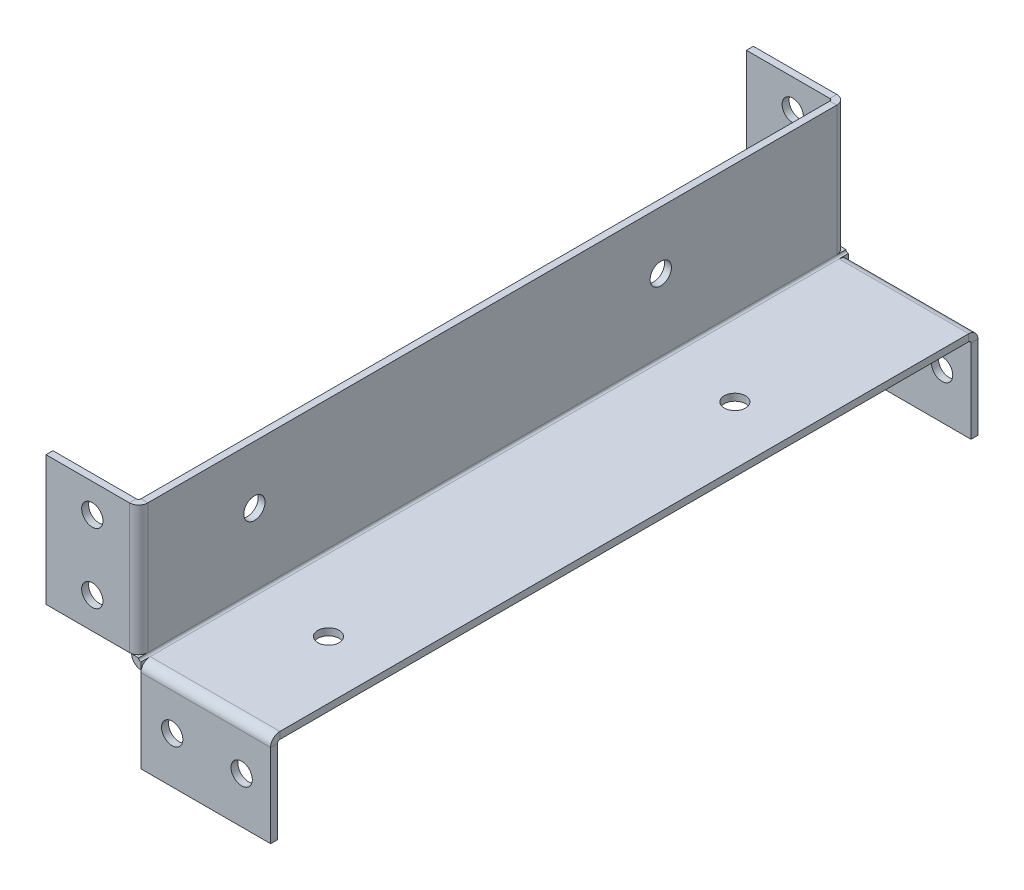
from build123d import *

# Parameters (mm, degrees)
SKETCH1_W                      = 60
SKETCH1_H                      = 305.5
BASE_FLANGE1_DEPTH             = 3
EDGE_FLANGE1_STRIP_W           = 14
EDGE_FLANGE1_STRIP_H           = 3
EDGE_FLANGE1_STRIP_CUT_DEPTH   = 305.5
EDGE_FLANGE1_DEPTH             = 305.5
EDGE_FLANGE2_STRIP_W           = 14
EDGE_FLANGE2_STRIP_H           = 3
EDGE_FLANGE2_STRIP_CUT_DEPTH   = 56
EDGE_FLANGE2_STRIP_2_W         = 14
EDGE_FLANGE2_STRIP_2_H         = 3
EDGE_FLANGE2_STRIP_CUT_2_DEPTH = 56
EDGE_FLANGE2_STRIP_3_W         = 14
EDGE_FLANGE2_STRIP_3_H         = 3
EDGE_FLANGE2_STRIP_CUT_3_DEPTH = 56
EDGE_FLANGE2_STRIP_4_W         = 14
EDGE_FLANGE2_STRIP_4_H         = 3
EDGE_FLANGE2_STRIP_CUT_4_DEPTH = 56
EDGE_FLANGE2_DEPTH             = 56
EDGE_FLANGE2_BEND_DEPTH        = 56
EDGE_FLANGE2_BEND_2_DEPTH      = 56
EDGE_FLANGE2_BEND_3_DEPTH      = 56
SKETCH18_R                     = 4.6
EXTRUDE1_DEPTH                 = 319.463891203
SKETCH19_R                     = 4.6
EXTRUDE2_DEPTH                 = 3
SKETCH20_R                     = 4.6
EXTRUDE3_DEPTH                 = 3


# Sheet-metal steps are written as plain solids
with BuildPart() as part:
    # Sketch1 → Base-Flange1 (new body)
    with BuildSketch(Plane(origin=(0, 0, 0), x_dir=(1, 0, 0), z_dir=(0, 1, 0))):
        Rectangle(SKETCH1_W, SKETCH1_H)
    extrude(amount=BASE_FLANGE1_DEPTH)

    # Edge-Flange1 strip (across the edge) → Edge-Flange1 strip cut (cut)
    with BuildSketch(Plane(origin=(-30, 3, -152.75), x_dir=(1, 0, 0), z_dir=(0, 0, 1))):
        with Locations((-3, -1.5)):
            Rectangle(EDGE_FLANGE1_STRIP_W, EDGE_FLANGE1_STRIP_H)
    extrude(amount=EDGE_FLANGE1_STRIP_CUT_DEPTH, mode=Mode.SUBTRACT)

    # Edge-Flange1 section (across the edge) → Edge-Flange1 (add)
    with BuildSketch(Plane(origin=(-30, 3, -152.75), x_dir=(1, 0, 0), z_dir=(0, 0, 1))):
        with BuildLine():
            Line((0, 1), (0, 57))
            Line((0, 57), (3, 57))
            Line((3, 57), (3, 1))
            ThreePointArc((3, 1), (3.292893219, 0.292893219), (4, 0))
            Line((4, 0), (4, -3))
            ThreePointArc((4, -3), (1.171572875, -1.828427125), (0, 1))
        make_face()
    extrude(amount=EDGE_FLANGE1_DEPTH)

    # Edge-Flange2 strip (across the edge) → Edge-Flange2 strip cut (cut)
    with BuildSketch(Plane(origin=(-30, 4, 152.75), x_dir=(0, 0, -1), z_dir=(0, 1, 0))):
        with Locations((-3, -1.5)):
            Rectangle(EDGE_FLANGE2_STRIP_W, EDGE_FLANGE2_STRIP_H)
    extrude(amount=EDGE_FLANGE2_STRIP_CUT_DEPTH, mode=Mode.SUBTRACT)

    # Edge-Flange2 strip 2 (across the edge) → Edge-Flange2 strip cut 2 (cut)
    with BuildSketch(Plane(origin=(30, 0, 152.75), x_dir=(0, 0, -1), z_dir=(-1, 0, 0))):
        with Locations((-3, -1.5)):
            Rectangle(EDGE_FLANGE2_STRIP_2_W, EDGE_FLANGE2_STRIP_2_H)
    extrude(amount=EDGE_FLANGE2_STRIP_CUT_2_DEPTH, mode=Mode.SUBTRACT)

    # Edge-Flange2 strip 3 (across the edge) → Edge-Flange2 strip cut 3 (cut)
    with BuildSketch(Plane(origin=(-30, 60, -152.75), x_dir=(0, 0, 1), z_dir=(0, -1, 0))):
        with Locations((-3, -1.5)):
            Rectangle(EDGE_FLANGE2_STRIP_3_W, EDGE_FLANGE2_STRIP_3_H)
    extrude(amount=EDGE_FLANGE2_STRIP_CUT_3_DEPTH, mode=Mode.SUBTRACT)

    # Edge-Flange2 strip 4 (across the edge) → Edge-Flange2 strip cut 4 (cut)
    with BuildSketch(Plane(origin=(-26, 0, -152.75), x_dir=(0, 0, 1), z_dir=(1, 0, 0))):
        with Locations((-3, -1.5)):
            Rectangle(EDGE_FLANGE2_STRIP_4_W, EDGE_FLANGE2_STRIP_4_H)
    extrude(amount=EDGE_FLANGE2_STRIP_CUT_4_DEPTH, mode=Mode.SUBTRACT)

    # Edge-Flange2 section (across the edge) → Edge-Flange2 (add)
    with BuildSketch(Plane(origin=(-30, 4, 152.75), x_dir=(0, 0, -1), z_dir=(0, 1, 0))):
        with BuildLine():
            Line((0, 1), (0, 37))
            Line((0, 37), (3, 37))
            Line((3, 37), (3, 1))
            ThreePointArc((3, 1), (3.292893219, 0.292893219), (4, 0))
            Line((4, 0), (4, -3))
            ThreePointArc((4, -3), (1.171572875, -1.828427125), (0, 1))
        make_face()
    extrude(amount=EDGE_FLANGE2_DEPTH)

    # Edge-Flange2 section 2 (across the edge) → Edge-Flange2 bend (add)
    with BuildSketch(Plane(origin=(30, 0, 152.75), x_dir=(0, 0, -1), z_dir=(-1, 0, 0))):
        with BuildLine():
            Line((0, 1), (0, 37))
            Line((0, 37), (3, 37))
            Line((3, 37), (3, 1))
            ThreePointArc((3, 1), (3.292893219, 0.292893219), (4, 0))
            Line((4, 0), (4, -3))
            ThreePointArc((4, -3), (1.171572875, -1.828427125), (0, 1))
        make_face()
    extrude(amount=EDGE_FLANGE2_BEND_DEPTH)

    # Edge-Flange2 section 3 (across the edge) → Edge-Flange2 bend 2 (add)
    with BuildSketch(Plane(origin=(-30, 60, -152.75), x_dir=(0, 0, 1), z_dir=(0, -1, 0))):
        with BuildLine():
            Line((0, 1), (0, 37))
            Line((0, 37), (3, 37))
            Line((3, 37), (3, 1))
            ThreePointArc((3, 1), (3.292893219, 0.292893219), (4, 0))
            Line((4, 0), (4, -3))
            ThreePointArc((4, -3), (1.171572875, -1.828427125), (0, 1))
        make_face()
    extrude(amount=EDGE_FLANGE2_BEND_2_DEPTH)

    # Edge-Flange2 section 4 (across the edge) → Edge-Flange2 bend 3 (add)
    with BuildSketch(Plane(origin=(-26, 0, -152.75), x_dir=(0, 0, 1), z_dir=(1, 0, 0))):
        with BuildLine():
            Line((0, 1), (0, 37))
            Line((0, 37), (3, 37))
            Line((3, 37), (3, 1))
            ThreePointArc((3, 1), (3.292893219, 0.292893219), (4, 0))
            Line((4, 0), (4, -3))
            ThreePointArc((4, -3), (1.171572875, -1.828427125), (0, 1))
        make_face()
    extrude(amount=EDGE_FLANGE2_BEND_3_DEPTH)

    # Sketch18 → Extrude1 (cut, through all)
    with BuildSketch(Plane.XY.offset(152.75)):
        with Locations((-47, 47.5)):
            Circle(SKETCH18_R)
        with Locations((-47, 17.5)):
            Circle(SKETCH18_R)
        with Locations((-12.5, -17)):
            Circle(SKETCH18_R)
        with Locations((17.5, -17)):
            Circle(SKETCH18_R)
    extrude(amount=-EXTRUDE1_DEPTH, mode=Mode.SUBTRACT)

    # Sketch19 → Extrude2 (cut)
    with BuildSketch(Plane(origin=(-27, 0, 0), x_dir=(0, 0, -1), z_dir=(1, 0, 0))):
        with Locations(Location((-102.75, 35, 0), (0, 0, 90))):
            Circle(SKETCH19_R)
        with Locations(Location((72.75, 35, 0), (0, 0, 90))):
            Circle(SKETCH19_R)
    extrude(amount=-EXTRUDE2_DEPTH, mode=Mode.SUBTRACT)

    # Sketch20 → Extrude3 (cut)
    with BuildSketch(Plane(origin=(0, 3, 0), x_dir=(1, 0, 0), z_dir=(0, 1, 0))):
        with Locations(Location((5, 72.75, 0), (0, 0, 270))):
            Circle(SKETCH20_R)
        with Locations(Location((5, -102.75, 0), (0, 0, 270))):
            Circle(SKETCH20_R)
    extrude(amount=-EXTRUDE3_DEPTH, mode=Mode.SUBTRACT)


solid = part.part
